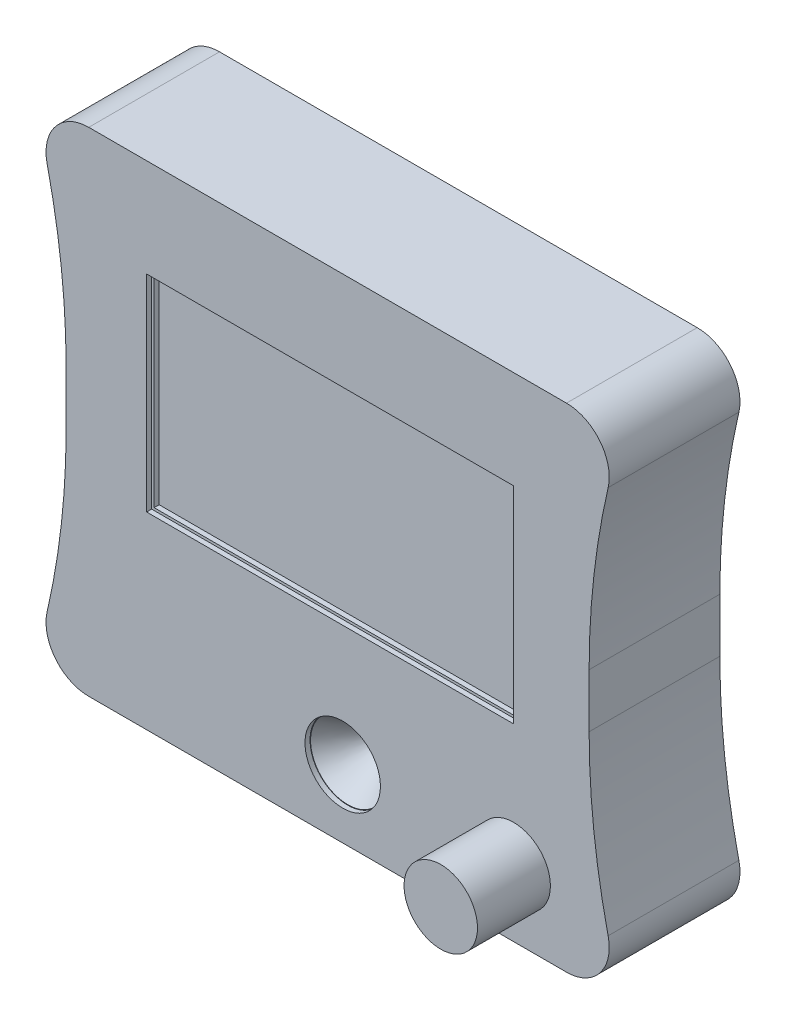
from build123d import *

# Parameters (mm, degrees)
ESQUISSE1_W              = 78
ESQUISSE1_H              = 51
BOSS_EXTRU_1_DEPTH       = 8
ESQUISSE2_W              = 72
ESQUISSE2_H              = 40
ESQUISSE2_H_2            = 1
ENL_V_MAT_EXTRU_1_DEPTH  = 1
ESQUISSE3_W              = 5
ESQUISSE3_H              = 43
BOSS_EXTRU_2_DEPTH       = 3.5
ESQUISSE4_W              = 93
ESQUISSE4_H              = 70
ESQUISSE4_R              = 1.5
BOSS_EXTRU_3_DEPTH       = 1.5
ESQUISSE5_W              = 93
ESQUISSE5_H              = 87
ESQUISSE5_R              = 1.5
BOSS_EXTRU_4_DEPTH       = 1.5
BOSS_EXTRU_5_DEPTH       = 25
ESQUISSE7_W              = 20
ESQUISSE7_H              = 9
ESQUISSE7_W_2            = 18
ESQUISSE7_H_2            = 7
BOSS_EXTRU_6_DEPTH       = 9
BOSS_EXTRU_6_2_DEPTH     = 9
ESQUISSE8_W              = 13
ESQUISSE8_H              = 11.5
BOSS_EXTRU_7_DEPTH       = 4
ESQUISSE8_W_2            = 7
ESQUISSE8_H_2            = 6
BOSS_EXTRU_7_2_DEPTH     = 4
ESQUISSE9_W              = 13
ESQUISSE9_H              = 11.5
BOSS_EXTRU_8_DEPTH       = 3
ESQUISSE10_R             = 3
BOSS_EXTRU_9_DEPTH       = 20
ESQUISSE11_W             = 20.196518619
ESQUISSE11_H             = 4.923957274
ENL_V_MAT_EXTRU_2_DEPTH  = 9
ESQUISSE12_R             = 6
BOSS_EXTRU_10_DEPTH      = 9.5
ESQUISSE13_R             = 3
BOSS_EXTRU_11_DEPTH      = 2
ESQUISSE14_W             = 6
ESQUISSE14_H             = 6
BOSS_EXTRU_12_DEPTH      = 3.3
ESQUISSE15_R             = 1.65
BOSS_EXTRU_13_DEPTH      = 1.5
EXTRUDE_THIN1_DEPTH      = 8
EXTRUDE_THIN1_DEPTH_BACK = 5.5
EXTRUDE_THIN2_DEPTH      = 10
SKETCH3_W                = 21
SKETCH3_H                = 10
BOSS_EXTRUDE1_DEPTH      = 1
EXTRUDE_THIN3_DEPTH      = 25
SKETCH5_R                = 3.9
SKETCH5_R_2              = 7.5
SKETCH5_W                = 73
SKETCH5_H                = 41
BOSS_EXTRUDE2_DEPTH      = 1
EXTRUDE_THIN4_START      = 6
EXTRUDE_THIN4_DEPTH      = 8
SKETCH9_R                = 7.3
SKETCH9_R_2              = 5.3
EXTRUDE_THIN5_DEPTH      = 13.5
SKETCH10_R               = 7.3
BOSS_EXTRUDE3_DEPTH      = 1


with BuildPart() as part:
    # Esquisse1 → Boss.-Extru.1 (new body)
    with BuildSketch(Plane.XY):
        with Locations((0, 25.5)):
            Rectangle(ESQUISSE1_W, ESQUISSE1_H)
    extrude(amount=BOSS_EXTRU_1_DEPTH)

    # Esquisse2 → Enlèv. mat.-Extru.1 (cut)
    with BuildSketch(Plane.XY.offset(8)):
        with Locations((0, 25.5)):
            Rectangle(ESQUISSE2_W, ESQUISSE2_H)
        with Locations((0, 2.75)):
            Rectangle(ESQUISSE2_W, ESQUISSE2_H_2)
        with Locations((0, 48.25)):
            Rectangle(ESQUISSE2_W, ESQUISSE2_H_2)
    extrude(amount=-ENL_V_MAT_EXTRU_1_DEPTH, mode=Mode.SUBTRACT)


with BuildPart() as body_2:
    # Esquisse3 → Boss.-Extru.2 (new body)
    with BuildSketch(Plane(origin=(0, 0, 0), x_dir=(-1, 0, 0), z_dir=(0, 0, -1))):
        with Locations((41.5, 25.5)):
            Rectangle(ESQUISSE3_W, ESQUISSE3_H)
    extrude(amount=-BOSS_EXTRU_2_DEPTH)


with BuildPart() as body_3:
    # Esquisse4 → Boss.-Extru.3 (new body)
    with BuildSketch(Plane(origin=(0, 0, 0), x_dir=(-1, 0, 0), z_dir=(0, 0, -1))):
        with Locations((0.5, 25)):
            Rectangle(ESQUISSE4_W, ESQUISSE4_H)
        with Locations((-43.5, 57.5)):
            Circle(ESQUISSE4_R, mode=Mode.SUBTRACT)
        with Locations(Location((-43.5, -7.5, 0), (0, 0, 180))):
            Circle(ESQUISSE4_R, mode=Mode.SUBTRACT)
        with Locations(Location((44.5, 57.5, 0), (0, 0, 180))):
            Circle(ESQUISSE4_R, mode=Mode.SUBTRACT)
        with Locations((44.5, -7.5)):
            Circle(ESQUISSE4_R, mode=Mode.SUBTRACT)
    extrude(amount=BOSS_EXTRU_3_DEPTH)


with BuildPart() as body_4:
    # Esquisse5 → Boss.-Extru.4 (new body)
    with BuildSketch(Plane(origin=(0, 0, -4), x_dir=(-1, 0, 0), z_dir=(0, 0, -1))):
        with Locations((0.5, 16.5)):
            Rectangle(ESQUISSE5_W, ESQUISSE5_H)
        with Locations((-43.5, 57.5)):
            Circle(ESQUISSE5_R, mode=Mode.SUBTRACT)
        with Locations((-43.5, -7.5)):
            Circle(ESQUISSE5_R, mode=Mode.SUBTRACT)
        with Locations((44.5, -7.5)):
            Circle(ESQUISSE5_R, mode=Mode.SUBTRACT)
        with Locations((44.5, 57.5)):
            Circle(ESQUISSE5_R, mode=Mode.SUBTRACT)
    extrude(amount=BOSS_EXTRU_4_DEPTH)


with BuildPart() as body_5:
    # Esquisse6 → Boss.-Extru.5 (new body)
    with BuildSketch(Plane.ZY.offset(47)):
        Polygon((-5.5, 38.5), (-8.5, 38.5), (-8.5, 12), (-5.5, 12), (-5.5, 12.25), (-8.25, 12.25), (-8.25, 38.25), (-5.5, 38.25), align=None)
    extrude(amount=-BOSS_EXTRU_5_DEPTH)


with BuildPart() as body_6:
    # Esquisse7 → Boss.-Extru.6 (new body)
    with BuildSketch(Plane(origin=(0, 0, -5.5), x_dir=(-1, 0, 0), z_dir=(0, 0, -1))):
        with Locations((16, 49)):
            Rectangle(ESQUISSE7_W, ESQUISSE7_H)
        with Locations((16, 49)):
            Rectangle(ESQUISSE7_W_2, ESQUISSE7_H_2, mode=Mode.SUBTRACT)
    extrude(amount=BOSS_EXTRU_6_DEPTH)


with BuildPart() as body_7:
    # Esquisse7 → Boss.-Extru.6 2 (new body)
    with BuildSketch(Plane(origin=(0, 0, -5.5), x_dir=(-1, 0, 0), z_dir=(0, 0, -1))):
        with Locations((-14, 49)):
            Rectangle(ESQUISSE7_W, ESQUISSE7_H)
        with Locations((-14, 49)):
            Rectangle(ESQUISSE7_W_2, ESQUISSE7_H_2, mode=Mode.SUBTRACT)
    extrude(amount=BOSS_EXTRU_6_2_DEPTH)


with BuildPart() as body_8:
    # Esquisse8 → Boss.-Extru.7 (new body)
    with BuildSketch(Plane.XY.offset(-4)):
        with Locations((37, -18.75)):
            Rectangle(ESQUISSE8_W, ESQUISSE8_H)
    extrude(amount=BOSS_EXTRU_7_DEPTH)


with BuildPart() as body_9:
    # Esquisse8 → Boss.-Extru.7 2 (new body)
    with BuildSketch(Plane.XY.offset(-4)):
        with Locations((-38.5, -16)):
            Rectangle(ESQUISSE8_W_2, ESQUISSE8_H_2)
    extrude(amount=BOSS_EXTRU_7_2_DEPTH)


with BuildPart() as body_10:
    # Esquisse9 → Boss.-Extru.8 (new body)
    with BuildSketch(Plane.XY):
        with Locations((37, -18.75)):
            Rectangle(ESQUISSE9_W, ESQUISSE9_H)
    extrude(amount=BOSS_EXTRU_8_DEPTH)


with BuildPart() as body_11:
    # Esquisse10 → Boss.-Extru.9 (new body)
    with BuildSketch(Plane.XY.offset(3)):
        with Locations((37, -18.75)):
            Circle(ESQUISSE10_R)
    extrude(amount=BOSS_EXTRU_9_DEPTH)

    # Esquisse11 → Enlèv. mat.-Extru.2 (cut)
    with BuildSketch(Plane.XY.offset(23)):
        with Locations((48.812511681, -18.75)):
            Rectangle(ESQUISSE11_W, ESQUISSE11_H)
    extrude(amount=-ENL_V_MAT_EXTRU_2_DEPTH, mode=Mode.SUBTRACT)


with BuildPart() as body_12:
    # Esquisse12 → Boss.-Extru.10 (new body)
    with BuildSketch(Plane.XY.offset(-4)):
        with Locations((18.5, -18)):
            Circle(ESQUISSE12_R)
    extrude(amount=BOSS_EXTRU_10_DEPTH)


with BuildPart() as body_13:
    # Esquisse13 → Boss.-Extru.11 (new body)
    with BuildSketch(Plane.XY):
        with Locations((-38.5, -16)):
            Circle(ESQUISSE13_R)
        Polygon((-38, -13.5), (-39, -13.5), (-39, -15.5), (-41, -15.5), (-41, -16.5), (-39, -16.5), (-39, -18.5), (-38, -18.5), (-38, -16.5), (-36, -16.5), (-36, -15.5), (-38, -15.5), align=None, mode=Mode.SUBTRACT)
    extrude(amount=BOSS_EXTRU_11_DEPTH)


with BuildPart() as body_14:
    # Esquisse14 → Boss.-Extru.12 (new body)
    with BuildSketch(Plane.XY.offset(-4)):
        with Locations((2.5, -19)):
            Rectangle(ESQUISSE14_W, ESQUISSE14_H)
    extrude(amount=BOSS_EXTRU_12_DEPTH)


with BuildPart() as body_15:
    # Esquisse15 → Boss.-Extru.13 (new body)
    with BuildSketch(Plane.XY.offset(-0.7)):
        with Locations((2.5, -19)):
            Circle(ESQUISSE15_R)
    extrude(amount=BOSS_EXTRU_13_DEPTH)


with BuildPart() as body_16:
    # Sketch1 → Extrude-Thin1 (new, two sides: drawn at the far end of the back side and taken through both)
    with BuildSketch(Plane.XY.offset(-EXTRUDE_THIN1_DEPTH_BACK)):
        with BuildLine():
            ThreePointArc((-51, 51.803847577), (-53.795554958, 58.552914271), (-48, 63))
            Line((-48, 63), (47, 63))
            ThreePointArc((47, 63), (52.795554958, 58.552914271), (50, 51.803847577))
            ThreePointArc((50, 51.803847577), (49.267949192, 51.07179677), (49, 50.07179677))
            Line((49, 50.07179677), (49, -17.07179677))
            ThreePointArc((49, -17.07179677), (49.267949192, -18.07179677), (50, -18.803847577))
            ThreePointArc((50, -18.803847577), (52.795554958, -25.552914271), (47, -30))
            Line((47, -30), (-48, -30))
            ThreePointArc((-48, -30), (-53.795554958, -25.552914271), (-51, -18.803847577))
            ThreePointArc((-51, -18.803847577), (-50.267949192, -18.07179677), (-50, -17.07179677))
            Line((-50, -17.07179677), (-50, 50.07179677))
            ThreePointArc((-50, 50.07179677), (-50.267949192, 51.07179677), (-51, 51.803847577))
        make_face()
        with BuildLine():
            ThreePointArc((-50, 53.535898385), (-51.863703305, 58.03527618), (-48, 61))
            Line((-48, 61), (47, 61))
            ThreePointArc((47, 61), (50.863703305, 58.03527618), (49, 53.535898385))
            ThreePointArc((49, 53.535898385), (47.535898385, 52.07179677), (47, 50.07179677))
            Line((47, 50.07179677), (47, -17.07179677))
            ThreePointArc((47, -17.07179677), (47.535898385, -19.07179677), (49, -20.535898385))
            ThreePointArc((49, -20.535898385), (50.863703305, -25.03527618), (47, -28))
            Line((47, -28), (-48, -28))
            ThreePointArc((-48, -28), (-51.863703305, -25.03527618), (-50, -20.535898385))
            ThreePointArc((-50, -20.535898385), (-48.535898385, -19.07179677), (-48, -17.07179677))
            Line((-48, -17.07179677), (-48, 50.07179677))
            ThreePointArc((-48, 50.07179677), (-48.535898385, 52.07179677), (-50, 53.535898385))
        make_face(mode=Mode.SUBTRACT)
    extrude(amount=EXTRUDE_THIN1_DEPTH + EXTRUDE_THIN1_DEPTH_BACK)

    # Sketch2 → Extrude-Thin2 (add)
    with BuildSketch(Plane(origin=(0, 0, -5.5), x_dir=(-1, 0, 0), z_dir=(0, 0, -1))):
        with BuildLine():
            Line((-43.45, 60.40473751), (-43.45, 60.6))
            ThreePointArc((-43.45, 60.6), (-42.747056275, 62.297056275), (-41.05, 63))
            Line((-41.05, 63), (42.05, 63))
            ThreePointArc((42.05, 63), (43.747056275, 62.297056275), (44.45, 60.6))
            Line((44.45, 60.6), (44.45, 60.40473751))
            ThreePointArc((44.45, 60.40473751), (44.22642875, 59.393224833), (43.597368421, 58.570166451))
            ThreePointArc((43.597368421, 58.570166451), (44.5, 56.1), (45.402631579, 58.570166451))
            ThreePointArc((45.402631579, 58.570166451), (44.77357125, 59.393224833), (44.55, 60.40473751))
            Line((44.55, 60.40473751), (44.55, 60.6))
            ThreePointArc((44.55, 60.6), (45.252943725, 62.297056275), (46.95, 63))
            Line((46.95, 63), (48, 63))
            ThreePointArc((48, 63), (53.795554958, 58.552914271), (51, 51.803847577))
            ThreePointArc((51, 51.803847577), (50.267949192, 51.07179677), (50, 50.07179677))
            Line((50, 50.07179677), (50, -5.05))
            ThreePointArc((50, -5.05), (49.297056275, -6.747056275), (47.6, -7.45))
            Line((47.6, -7.45), (47.40473751, -7.45))
            ThreePointArc((47.40473751, -7.45), (46.393224833, -7.22642875), (45.570166451, -6.597368421))
            ThreePointArc((45.570166451, -6.597368421), (43.1, -7.5), (45.570166451, -8.402631579))
            ThreePointArc((45.570166451, -8.402631579), (46.393224833, -7.77357125), (47.40473751, -7.55))
            Line((47.40473751, -7.55), (47.6, -7.55))
            ThreePointArc((47.6, -7.55), (49.297056275, -8.252943725), (50, -9.95))
            Line((50, -9.95), (50, -17.07179677))
            ThreePointArc((50, -17.07179677), (50.267949192, -18.07179677), (51, -18.803847577))
            ThreePointArc((51, -18.803847577), (53.795554958, -25.552914271), (48, -30))
            Line((48, -30), (-47, -30))
            ThreePointArc((-47, -30), (-52.795554958, -25.552914271), (-50, -18.803847577))
            ThreePointArc((-50, -18.803847577), (-49.267949192, -18.07179677), (-49, -17.07179677))
            Line((-49, -17.07179677), (-49, -9.95))
            ThreePointArc((-49, -9.95), (-48.297056275, -8.252943725), (-46.6, -7.55))
            Line((-46.6, -7.55), (-46.40473751, -7.55))
            ThreePointArc((-46.40473751, -7.55), (-45.393224833, -7.77357125), (-44.570166451, -8.402631579))
            ThreePointArc((-44.570166451, -8.402631579), (-42.1, -7.5), (-44.570166451, -6.597368421))
            ThreePointArc((-44.570166451, -6.597368421), (-45.393224833, -7.22642875), (-46.40473751, -7.45))
            Line((-46.40473751, -7.45), (-46.6, -7.45))
            ThreePointArc((-46.6, -7.45), (-48.297056275, -6.747056275), (-49, -5.05))
            Line((-49, -5.05), (-49, 50.07179677))
            ThreePointArc((-49, 50.07179677), (-49.267949192, 51.07179677), (-50, 51.803847577))
            ThreePointArc((-50, 51.803847577), (-52.795554958, 58.552914271), (-47, 63))
            Line((-47, 63), (-45.95, 63))
            ThreePointArc((-45.95, 63), (-44.252943725, 62.297056275), (-43.55, 60.6))
            Line((-43.55, 60.6), (-43.55, 60.40473751))
            ThreePointArc((-43.55, 60.40473751), (-43.77357125, 59.393224833), (-44.402631579, 58.570166451))
            ThreePointArc((-44.402631579, 58.570166451), (-43.5, 56.1), (-42.597368421, 58.570166451))
            ThreePointArc((-42.597368421, 58.570166451), (-43.22642875, 59.393224833), (-43.45, 60.40473751))
        make_face()
        with BuildLine():
            Line((-41.45, 60.40473751), (-41.45, 60.6))
            ThreePointArc((-41.45, 60.6), (-41.332842712, 60.882842712), (-41.05, 61))
            Line((-41.05, 61), (42.05, 61))
            ThreePointArc((42.05, 61), (42.332842712, 60.882842712), (42.45, 60.6))
            Line((42.45, 60.6), (42.45, 60.40473751))
            ThreePointArc((42.45, 60.40473751), (42.412738125, 60.236152064), (42.307894737, 60.098975667))
            ThreePointArc((42.307894737, 60.098975667), (44.5, 54.1), (46.692105263, 60.098975667))
            ThreePointArc((46.692105263, 60.098975667), (46.587261875, 60.236152064), (46.55, 60.40473751))
            Line((46.55, 60.40473751), (46.55, 60.6))
            ThreePointArc((46.55, 60.6), (46.667157288, 60.882842712), (46.95, 61))
            Line((46.95, 61), (48, 61))
            ThreePointArc((48, 61), (51.863703305, 58.03527618), (50, 53.535898385))
            ThreePointArc((50, 53.535898385), (48.535898385, 52.07179677), (48, 50.07179677))
            Line((48, 50.07179677), (48, -5.05))
            ThreePointArc((48, -5.05), (47.882842712, -5.332842712), (47.6, -5.45))
            Line((47.6, -5.45), (47.40473751, -5.45))
            ThreePointArc((47.40473751, -5.45), (47.236152064, -5.412738125), (47.098975667, -5.307894737))
            ThreePointArc((47.098975667, -5.307894737), (41.1, -7.5), (47.098975667, -9.692105263))
            ThreePointArc((47.098975667, -9.692105263), (47.236152064, -9.587261875), (47.40473751, -9.55))
            Line((47.40473751, -9.55), (47.6, -9.55))
            ThreePointArc((47.6, -9.55), (47.882842712, -9.667157288), (48, -9.95))
            Line((48, -9.95), (48, -17.07179677))
            ThreePointArc((48, -17.07179677), (48.535898385, -19.07179677), (50, -20.535898385))
            ThreePointArc((50, -20.535898385), (51.863703305, -25.03527618), (48, -28))
            Line((48, -28), (-47, -28))
            ThreePointArc((-47, -28), (-50.863703305, -25.03527618), (-49, -20.535898385))
            ThreePointArc((-49, -20.535898385), (-47.535898385, -19.07179677), (-47, -17.07179677))
            Line((-47, -17.07179677), (-47, -9.95))
            ThreePointArc((-47, -9.95), (-46.882842712, -9.667157288), (-46.6, -9.55))
            Line((-46.6, -9.55), (-46.40473751, -9.55))
            ThreePointArc((-46.40473751, -9.55), (-46.236152064, -9.587261875), (-46.098975667, -9.692105263))
            ThreePointArc((-46.098975667, -9.692105263), (-40.1, -7.5), (-46.098975667, -5.307894737))
            ThreePointArc((-46.098975667, -5.307894737), (-46.236152064, -5.412738125), (-46.40473751, -5.45))
            Line((-46.40473751, -5.45), (-46.6, -5.45))
            ThreePointArc((-46.6, -5.45), (-46.882842712, -5.332842712), (-47, -5.05))
            Line((-47, -5.05), (-47, 50.07179677))
            ThreePointArc((-47, 50.07179677), (-47.535898385, 52.07179677), (-49, 53.535898385))
            ThreePointArc((-49, 53.535898385), (-50.863703305, 58.03527618), (-47, 61))
            Line((-47, 61), (-45.95, 61))
            ThreePointArc((-45.95, 61), (-45.667157288, 60.882842712), (-45.55, 60.6))
            Line((-45.55, 60.6), (-45.55, 60.40473751))
            ThreePointArc((-45.55, 60.40473751), (-45.587261875, 60.236152064), (-45.692105263, 60.098975667))
            ThreePointArc((-45.692105263, 60.098975667), (-43.5, 54.1), (-41.307894737, 60.098975667))
            ThreePointArc((-41.307894737, 60.098975667), (-41.412738125, 60.236152064), (-41.45, 60.40473751))
        make_face(mode=Mode.SUBTRACT)
    extrude(amount=EXTRUDE_THIN2_DEPTH)

    # Sketch3 → Boss-Extrude1 (add)
    with BuildSketch(Plane(origin=(0, 0, -15.5), x_dir=(-1, 0, 0), z_dir=(0, 0, -1))):
        with BuildLine():
            Line((-49, 50.07179677), (-49, -17.07179677))
            ThreePointArc((-49, -17.07179677), (-49.267949192, -18.07179677), (-50, -18.803847577))
            ThreePointArc((-50, -18.803847577), (-52.795554958, -25.552914271), (-47, -30))
            Line((-47, -30), (48, -30))
            ThreePointArc((48, -30), (53.795554958, -25.552914271), (51, -18.803847577))
            ThreePointArc((51, -18.803847577), (50.267949192, -18.07179677), (50, -17.07179677))
            Line((50, -17.07179677), (50, 50.07179677))
            ThreePointArc((50, 50.07179677), (50.267949192, 51.07179677), (51, 51.803847577))
            ThreePointArc((51, 51.803847577), (53.795554958, 58.552914271), (48, 63))
            Line((48, 63), (-47, 63))
            ThreePointArc((-47, 63), (-52.795554958, 58.552914271), (-50, 51.803847577))
            ThreePointArc((-50, 51.803847577), (-49.267949192, 51.07179677), (-49, 50.07179677))
        make_face()
        with Locations((16, 49)):
            Rectangle(SKETCH3_W, SKETCH3_H, mode=Mode.SUBTRACT)
        with Locations((-14, 49)):
            Rectangle(SKETCH3_W, SKETCH3_H, mode=Mode.SUBTRACT)
    extrude(amount=BOSS_EXTRUDE1_DEPTH)


with BuildPart() as body_17:
    # Sketch4 → Extrude-Thin3 (new body)
    with BuildSketch(Plane.XY.offset(8)):
        with BuildLine():
            Line((51.5, 11.156791662), (51.5, 21.843208338))
            ThreePointArc((51.5, 21.843208338), (52.448727726, 38.574117538), (55.282747604, 55.090525692))
            ThreePointArc((55.282747604, 55.090525692), (53.651335641, 62.292422337), (47, 65.5))
            Line((47, 65.5), (-48, 65.5))
            ThreePointArc((-48, 65.5), (-54.651335641, 62.292422337), (-56.282747604, 55.090525692))
            ThreePointArc((-56.282747604, 55.090525692), (-53.448727726, 38.574117538), (-52.5, 21.843208338))
            Line((-52.5, 21.843208338), (-52.5, 11.156791662))
            ThreePointArc((-52.5, 11.156791662), (-53.448727726, -5.574117538), (-56.282747604, -22.090525692))
            ThreePointArc((-56.282747604, -22.090525692), (-54.651335641, -29.292422337), (-48, -32.5))
            Line((-48, -32.5), (47, -32.5))
            ThreePointArc((47, -32.5), (53.651335641, -29.292422337), (55.282747604, -22.090525692))
            ThreePointArc((55.282747604, -22.090525692), (52.448727726, -5.574117538), (51.5, 11.156791662))
        make_face()
        with BuildLine():
            Line((49.5, 11.156791662), (49.5, 21.843208338))
            ThreePointArc((49.5, 21.843208338), (50.461548371, 38.800210906), (53.333865815, 55.539813765))
            ThreePointArc((53.333865815, 55.539813765), (52.08631549, 61.047146493), (47, 63.5))
            Line((47, 63.5), (-48, 63.5))
            ThreePointArc((-48, 63.5), (-53.08631549, 61.047146493), (-54.333865815, 55.539813765))
            ThreePointArc((-54.333865815, 55.539813765), (-51.461548371, 38.800210906), (-50.5, 21.843208338))
            Line((-50.5, 21.843208338), (-50.5, 11.156791662))
            ThreePointArc((-50.5, 11.156791662), (-51.461548371, -5.800210906), (-54.333865815, -22.539813765))
            ThreePointArc((-54.333865815, -22.539813765), (-53.08631549, -28.047146493), (-48, -30.5))
            Line((-48, -30.5), (47, -30.5))
            ThreePointArc((47, -30.5), (52.08631549, -28.047146493), (53.333865815, -22.539813765))
            ThreePointArc((53.333865815, -22.539813765), (50.461548371, -5.800210906), (49.5, 11.156791662))
        make_face(mode=Mode.SUBTRACT)
    extrude(amount=-EXTRUDE_THIN3_DEPTH)

    # Sketch5 → Boss-Extrude2 (add)
    with BuildSketch(Plane.XY.offset(8)):
        with BuildLine():
            Line((-52.5, 21.843208338), (-52.5, 11.156791662))
            ThreePointArc((-52.5, 11.156791662), (-53.448727726, -5.574117538), (-56.282747604, -22.090525692))
            ThreePointArc((-56.282747604, -22.090525692), (-54.651335641, -29.292422337), (-48, -32.5))
            Line((-48, -32.5), (47, -32.5))
            ThreePointArc((47, -32.5), (53.651335641, -29.292422337), (55.282747604, -22.090525692))
            ThreePointArc((55.282747604, -22.090525692), (52.448727726, -5.574117538), (51.5, 11.156791662))
            Line((51.5, 11.156791662), (51.5, 21.843208338))
            ThreePointArc((51.5, 21.843208338), (52.448727726, 38.574117538), (55.282747604, 55.090525692))
            ThreePointArc((55.282747604, 55.090525692), (53.651335641, 62.292422337), (47, 65.5))
            Line((47, 65.5), (-48, 65.5))
            ThreePointArc((-48, 65.5), (-54.651335641, 62.292422337), (-56.282747604, 55.090525692))
            ThreePointArc((-56.282747604, 55.090525692), (-53.448727726, 38.574117538), (-52.5, 21.843208338))
        make_face()
        with Locations((37, -18.75)):
            Circle(SKETCH5_R, mode=Mode.SUBTRACT)
        with Locations((2.5, -19)):
            Circle(SKETCH5_R_2, mode=Mode.SUBTRACT)
        with Locations((0, 25.5)):
            Rectangle(SKETCH5_W, SKETCH5_H, mode=Mode.SUBTRACT)
    extrude(amount=BOSS_EXTRUDE2_DEPTH)

    # Sketch7 → Revolve1 (revolve)
    with BuildSketch(Plane(origin=(2.5, 0, 0), x_dir=(0, 0, -1), z_dir=(1, 0, 0)), mode=Mode.PRIVATE) as revolve1_sk:
        Polygon((-8, -11.6), (-1.268922161, -16.279201998), (-1.268922161, -13.843424684), (-8, -9.164222686), align=None)
    revolve(revolve1_sk.sketch.rotate(Axis((2.5, -19, 8), (0, 0, -1)), 90), axis=Axis((2.5, -19, 8), (0, 0, -1)))


with BuildPart() as body_18:
    # Sketch8 → Extrude-Thin4 (new body)
    with BuildSketch(Plane.XY.offset(9).offset(EXTRUDE_THIN4_START)):
        with BuildLine():
            Line((41.014252371, -15.44458355), (41.014252371, -22.05541645))
            ThreePointArc((41.014252371, -22.05541645), (31.8, -18.75), (41.014252371, -15.44458355))
        make_face()
        with BuildLine():
            Line((39.014252371, -16.263478858), (39.014252371, -21.236521142))
            ThreePointArc((39.014252371, -21.236521142), (33.8, -18.75), (39.014252371, -16.263478858))
        make_face(mode=Mode.SUBTRACT)
    extrude(amount=EXTRUDE_THIN4_DEPTH)



with BuildPart() as body_19:
    # Sketch9 → Extrude-Thin5 (new body)
    with BuildSketch(Plane.XY.offset(23)):
        with Locations((37, -18.75)):
            Circle(SKETCH9_R)
        with Locations((37, -18.75)):
            Circle(SKETCH9_R_2, mode=Mode.SUBTRACT)
    extrude(amount=-EXTRUDE_THIN5_DEPTH)


with BuildPart() as body_18_1:
    add(body_18.part)

    add(body_19.part)  # Boss-Extrude3 merges body 19
    # Sketch10 → Boss-Extrude3 (add)
    with BuildSketch(Plane.XY.offset(23)):
        with Locations((37, -18.75)):
            Circle(SKETCH10_R)
    extrude(amount=BOSS_EXTRUDE3_DEPTH)


solid = Compound([part.part, body_2.part, body_3.part, body_4.part, body_5.part, body_6.part, body_7.part, body_8.part, body_9.part, body_10.part, body_11.part, body_12.part, body_13.part, body_14.part, body_15.part, body_16.part, body_17.part, body_18_1.part])
